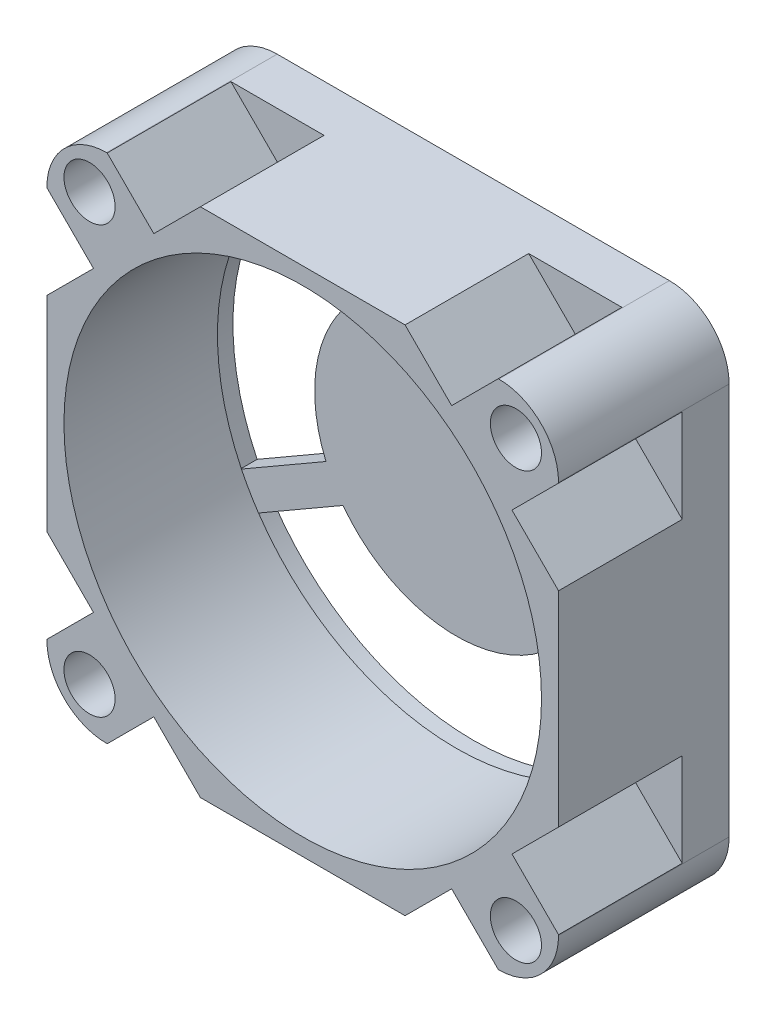
from build123d import *

# Parameters (mm, degrees)
SKETCH1_W             = 30
SKETCH1_H             = 30
BOSS_EXTRUDE1_DEPTH   = 10
SKETCH2_R             = 14
CUT_EXTRUDE1_DEPTH    = 9
CUT_EXTRUDE2_DEPTH    = 44.370496884
F_3_0MM_DOWEL_HOLE1_D = 3
CUT_EXTRUDE3_DEPTH    = 7.25
FILLET1_R             = 3.5


with BuildPart() as part:
    # Sketch1 → Boss-Extrude1 (new body)
    with BuildSketch(Plane.XY):
        with Locations((15, 15)):
            Rectangle(SKETCH1_W, SKETCH1_H)
    extrude(amount=BOSS_EXTRUDE1_DEPTH)

    # Sketch2 → Cut-Extrude1 (cut)
    with BuildSketch(Plane.XY.offset(10)):
        with Locations((15, 15)):
            Circle(SKETCH2_R)
    extrude(amount=-CUT_EXTRUDE1_DEPTH, mode=Mode.SUBTRACT)

    # Sketch3 → Cut-Extrude2 (cut, through all)
    with BuildSketch(Plane.XY.offset(1)):
        with BuildLine():
            Line((14, 23.239538822), (14, 29.05542131))
            ThreePointArc((14, 29.05542131), (2.79687945, 22.045474934), (2.327648085, 8.838314749))
            Line((2.327648085, 8.838314749), (7.364350065, 11.746255993))
            ThreePointArc((7.364350065, 11.746255993), (7.811989149, 19.15), (14, 23.239538822))
        make_face()
        with BuildLine():
            Line((16, 23.239538822), (16, 29.05542131))
            ThreePointArc((16, 29.05542131), (27.20312055, 22.045474934), (27.672351915, 8.838314749))
            Line((27.672351915, 8.838314749), (22.635649935, 11.746255993))
            ThreePointArc((22.635649935, 11.746255993), (22.188010851, 19.15), (16, 23.239538822))
        make_face()
        with BuildLine():
            Line((21.635649935, 10.014205185), (26.672351915, 7.106263941))
            ThreePointArc((26.672351915, 7.106263941), (15, 0.909050131), (3.327648085, 7.106263941))
            Line((3.327648085, 7.106263941), (8.364350065, 10.014205185))
            ThreePointArc((8.364350065, 10.014205185), (15, 6.7), (21.635649935, 10.014205185))
        make_face()
    extrude(amount=-CUT_EXTRUDE2_DEPTH, mode=Mode.SUBTRACT)

    # Ø3.0mm Dowel Hole1 (through all)
    with Locations(Plane(origin=(0, 0, 0), x_dir=(-1, 0, 0), z_dir=(0, 0, -1))):
        with Locations((-27.5, 27.5), (-2.5, 27.5), (-2.5, 2.5), (-27.5, 2.5)):
            Hole(F_3_0MM_DOWEL_HOLE1_D / 2)

    # Sketch6 → Cut-Extrude3 (cut)
    with BuildSketch(Plane.XY.offset(10)):
        Polygon((9, 30), (6.267766953, 27.267766953), (3.535533906, 30), align=None)
        Polygon((23.732233047, 27.267766953), (26.464466094, 30), (21, 30), align=None)
        Polygon((30, 26.464466094), (30, 21), (27.267766953, 23.732233047), align=None)
        Polygon((30, 9), (30, 3.535533906), (27.267766953, 6.267766953), align=None)
        Polygon((26.464466094, 0), (21, 0), (23.732233047, 2.732233047), align=None)
        Polygon((9, 0), (3.535533906, 0), (6.267766953, 2.732233047), align=None)
        Polygon((0, 3.535533906), (0, 9), (2.732233047, 6.267766953), align=None)
        Polygon((0, 21), (0, 26.464466094), (2.732233047, 23.732233047), align=None)
    extrude(amount=-CUT_EXTRUDE3_DEPTH, mode=Mode.SUBTRACT)

    # Fillet1
    fillet1_edges = [part.edges().sort_by_distance(p)[0] for p in [
        (30, 30, 5),
        (30, 0, 5),
        (0, 0, 5),
        (0, 30, 5),
    ]]
    fillet(fillet1_edges, radius=FILLET1_R)


solid = part.part
